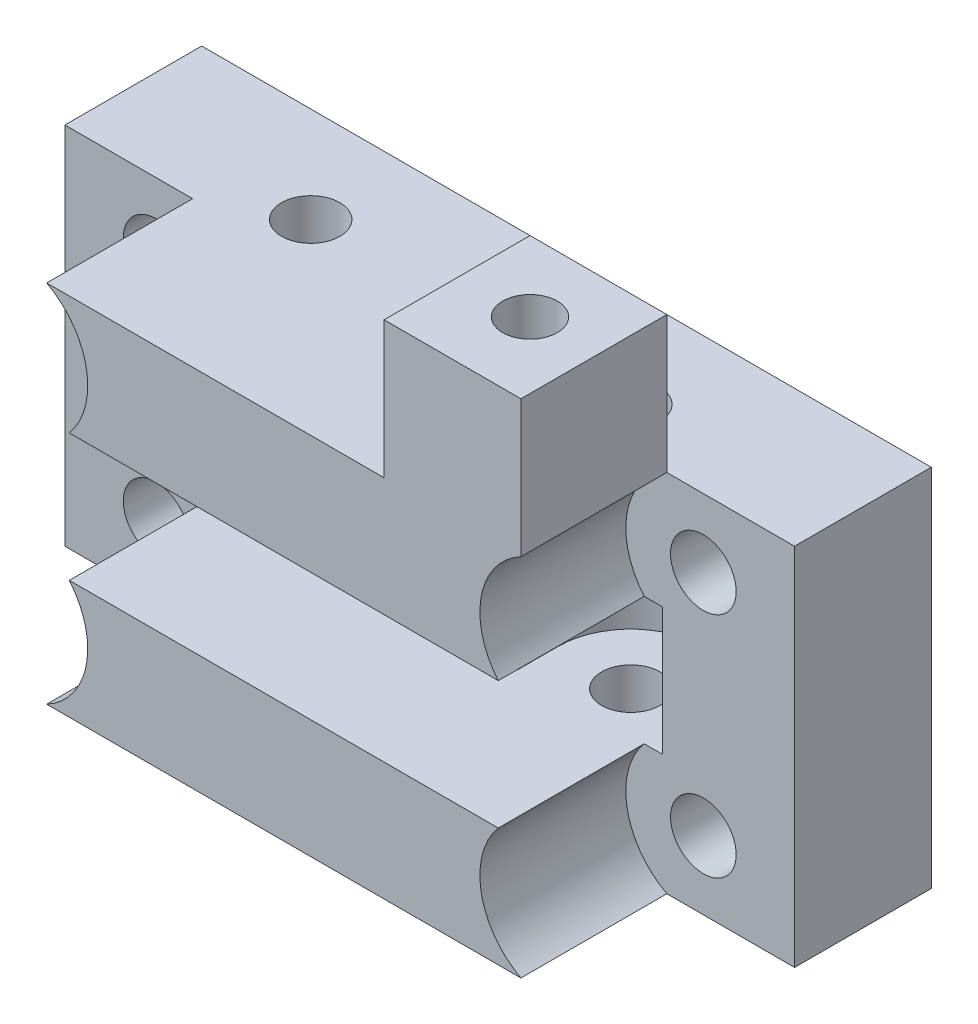
from build123d import *

# Parameters (mm, degrees)
SKETCH1_W               = 50.8
SKETCH1_H               = 25.4
BOSS_EXTRUDE1_DEPTH     = 4.7625
SKETCH2_R               = 2.286
CUT_EXTRUDE1_DEPTH      = 30.952890094
CUT_EXTRUDE2_DEPTH      = 4.445
SKETCH5_R               = 2.032
CUT_EXTRUDE3_DEPTH      = 37.235361268
BOSS_EXTRUDE2_DEPTH     = 10.16
MIRROR2_COPY_1_SKETCH_R = 2.286
MIRROR2_COPY_1_DEPTH    = 30.952890094
MIRROR2_COPY_2_DEPTH    = 10.16
MIRROR2_COPY_3_SKETCH_R = 2.286
MIRROR2_COPY_3_DEPTH    = 30.952890094
MIRROR2_COPY_4_DEPTH    = 10.16
SKETCH7_W               = 9.525
SKETCH7_H               = 10.16
BOSS_EXTRUDE3_DEPTH     = 9.525
SKETCH8_R               = 1.905
CUT_EXTRUDE4_DEPTH      = 6.35


with BuildPart() as part:
    # Sketch1 → Boss-Extrude1 (new, symmetric)
    with BuildSketch(Plane.XY):
        Rectangle(SKETCH1_W, SKETCH1_H)
    extrude(amount=BOSS_EXTRUDE1_DEPTH, both=True)

    # Sketch2 → Cut-Extrude1 (cut, through all)
    with BuildSketch(Plane.XY.offset(4.7625)):
        with Locations((-19.05, 7.9375)):
            Circle(SKETCH2_R)
    cut_extrude1 = extrude(amount=-CUT_EXTRUDE1_DEPTH, mode=Mode.SUBTRACT)

    # Sketch4 → Cut-Extrude2 (cut, symmetric)
    with BuildSketch(Plane(origin=(0, 0, 0), x_dir=(1, 0, 0), z_dir=(0, 1, 0))):
        with BuildLine():
            Line((-16.22425, -1.905), (-16.22425, -4.7625))
            Line((-16.22425, -4.7625), (-6.06425, -4.7625))
            Line((-6.06425, -4.7625), (-6.06425, -1.905))
            ThreePointArc((-6.06425, -1.905), (-11.14425, 3.175), (-16.22425, -1.905))
        make_face()
    cut_extrude2 = extrude(amount=CUT_EXTRUDE2_DEPTH, both=True, mode=Mode.SUBTRACT)

    # Sketch5 → Cut-Extrude3 (cut, through all)
    with BuildSketch(Plane(origin=(0, 12.7, 0), x_dir=(1, 0, 0), z_dir=(0, 1, 0))):
        with Locations((-11.14425, -1.905)):
            Circle(SKETCH5_R)
    cut_extrude3 = extrude(amount=-CUT_EXTRUDE3_DEPTH, mode=Mode.SUBTRACT)

    # Sketch6 → Boss-Extrude2 (add)
    with BuildSketch(Plane.XY.offset(4.7625)):
        with BuildLine():
            Line((-16.51, 12.7), (16.51, 12.7))
            ThreePointArc((16.51, 12.7), (13.748168987, 8.949228305), (14.934729657, 4.445))
            Line((14.934729657, 4.445), (-14.934729657, 4.445))
            ThreePointArc((-14.934729657, 4.445), (-13.748168987, 8.949228305), (-16.51, 12.7))
        make_face()
    boss_extrude2 = extrude(amount=BOSS_EXTRUDE2_DEPTH)

    # Mirror1: Cut-Extrude1, Boss-Extrude2 across plane
    add(cut_extrude1.mirror(Plane.ZX), mode=Mode.SUBTRACT)
    add(boss_extrude2.mirror(Plane.ZX))

    # Mirror2: Cut-Extrude2, Cut-Extrude3 across plane
    add(cut_extrude2.mirror(Plane(origin=(0, 0, 0), x_dir=(0, 0, 1), z_dir=(1, 0, 0))), mode=Mode.SUBTRACT)
    add(cut_extrude3.mirror(Plane(origin=(0, 0, 0), x_dir=(0, 0, 1), z_dir=(1, 0, 0))), mode=Mode.SUBTRACT)

    # Mirror2 copy 1 sketch → Mirror2 copy 1 (cut, through all)
    with BuildSketch(Plane(origin=(0, 0, 4.7625), x_dir=(-1, 0, 0), z_dir=(0, 0, 1))):
        with Locations((-19.05, 7.9375)):
            Circle(MIRROR2_COPY_1_SKETCH_R)
    extrude(amount=-MIRROR2_COPY_1_DEPTH, mode=Mode.SUBTRACT)

    # Mirror2 copy 2 sketch → Mirror2 copy 2 (add)
    with BuildSketch(Plane(origin=(0, 0, 4.7625), x_dir=(-1, 0, 0), z_dir=(0, 0, 1))):
        with BuildLine():
            Line((-16.51, 12.7), (16.51, 12.7))
            ThreePointArc((16.51, 12.7), (13.748168987, 8.949228305), (14.934729657, 4.445))
            Line((14.934729657, 4.445), (-14.934729657, 4.445))
            ThreePointArc((-14.934729657, 4.445), (-13.748168987, 8.949228305), (-16.51, 12.7))
        make_face()
    extrude(amount=MIRROR2_COPY_2_DEPTH)

    # Mirror2 copy 3 sketch → Mirror2 copy 3 (cut, through all)
    with BuildSketch(Plane(origin=(0, 0, 4.7625), x_dir=(-1, 0, 0), z_dir=(0, 0, 1))):
        with Locations((-19.05, -7.9375)):
            Circle(MIRROR2_COPY_3_SKETCH_R)
    extrude(amount=-MIRROR2_COPY_3_DEPTH, mode=Mode.SUBTRACT)

    # Mirror2 copy 4 sketch → Mirror2 copy 4 (add)
    with BuildSketch(Plane(origin=(0, 0, 4.7625), x_dir=(-1, 0, 0), z_dir=(0, 0, 1))):
        with BuildLine():
            Line((-16.51, -12.7), (16.51, -12.7))
            ThreePointArc((16.51, -12.7), (13.748168987, -8.949228305), (14.934729657, -4.445))
            Line((14.934729657, -4.445), (-14.934729657, -4.445))
            ThreePointArc((-14.934729657, -4.445), (-13.748168987, -8.949228305), (-16.51, -12.7))
        make_face()
    extrude(amount=MIRROR2_COPY_4_DEPTH)

    # Sketch7 → Boss-Extrude3 (add)
    with BuildSketch(Plane(origin=(0, 12.7, 0), x_dir=(1, 0, 0), z_dir=(0, 1, 0))):
        with Locations((11.7475, -9.8425)):
            Rectangle(SKETCH7_W, SKETCH7_H)
    extrude(amount=BOSS_EXTRUDE3_DEPTH)

    # Sketch8 → Cut-Extrude4 (cut)
    with BuildSketch(Plane(origin=(0, 22.225, 0), x_dir=(1, 0, 0), z_dir=(0, 1, 0))):
        with Locations((11.88669594, -9.667325107)):
            Circle(SKETCH8_R)
    extrude(amount=-CUT_EXTRUDE4_DEPTH, mode=Mode.SUBTRACT)


solid = part.part
